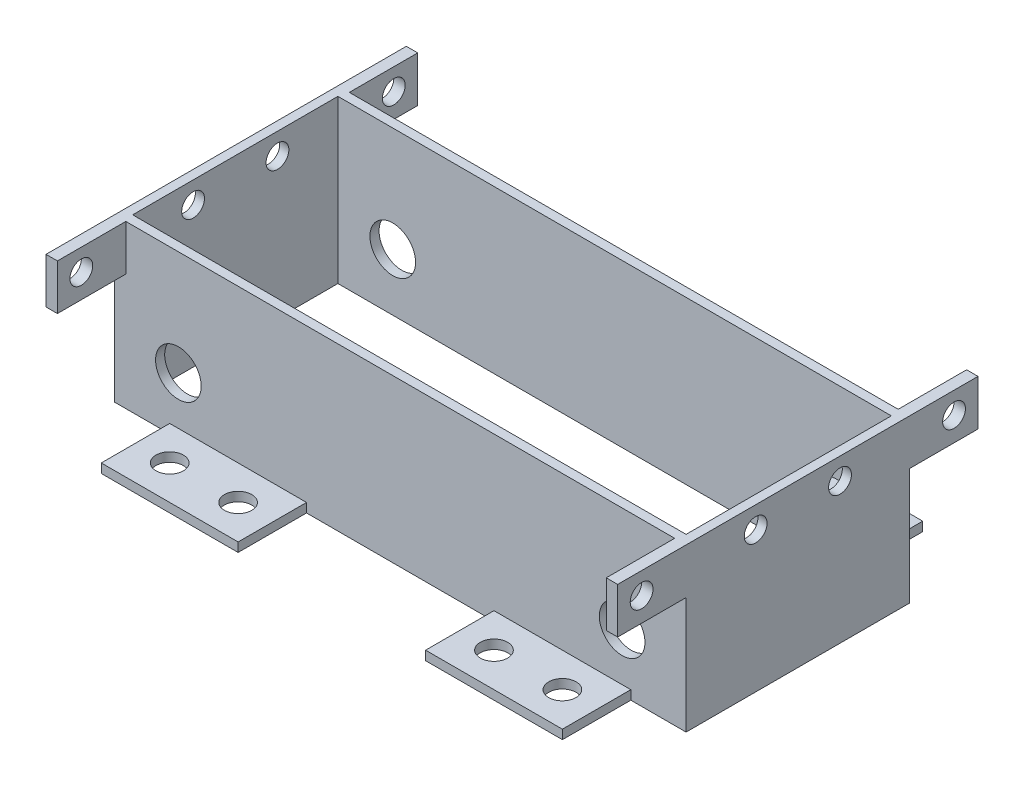
from build123d import *

# Parameters (mm, degrees)
SKETCH1_W           = 125.34
SKETCH1_H           = 35.55
SKETCH1_R           = 5
BOSS_EXTRUDE1_DEPTH = 2
SKETCH2_W           = 2
SKETCH2_H           = 35.55
BOSS_EXTRUDE2_DEPTH = 45
SKETCH4_W           = 30
SKETCH4_H           = 2
BOSS_EXTRUDE3_DEPTH = 15
SKETCH5_W           = 2.5
SKETCH5_H           = 10
BOSS_EXTRUDE4_DEPTH = 15
SKETCH3_R           = 2.5
CUT_EXTRUDE1_DEPTH  = 136.149051883
SKETCH6_R           = 3
CUT_EXTRUDE2_DEPTH  = 125.666080892


with BuildPart() as part:
    # Sketch1 → Boss-Extrude1 (new body)
    with BuildSketch(Plane.XY):
        with Locations((48.645, 5.25)):
            Rectangle(SKETCH1_W, SKETCH1_H)
        Circle(SKETCH1_R, mode=Mode.SUBTRACT)
        with Locations((97.29, 0)):
            Circle(SKETCH1_R, mode=Mode.SUBTRACT)
    boss_extrude1 = extrude(amount=BOSS_EXTRUDE1_DEPTH)

    # Sketch2 → Boss-Extrude2 (add)
    with BuildSketch(Plane(origin=(0, 0, 0), x_dir=(-1, 0, 0), z_dir=(0, 0, -1))):
        with Locations((-110.315, 5.25)):
            Rectangle(SKETCH2_W, SKETCH2_H)
    boss_extrude2 = extrude(amount=BOSS_EXTRUDE2_DEPTH)

    # Mirror1: Boss-Extrude2 across plane
    add(boss_extrude2.mirror(Plane(origin=(48.645, 0, 0), x_dir=(0, 0, 1), z_dir=(1, 0, 0))))

    # Sketch4 → Boss-Extrude3 (add)
    with BuildSketch(Plane.XY.offset(2)):
        with Locations((13.095, -11.525)):
            Rectangle(SKETCH4_W, SKETCH4_H)
        with Locations((84.195, -11.525)):
            Rectangle(SKETCH4_W, SKETCH4_H)
    boss_extrude3 = extrude(amount=BOSS_EXTRUDE3_DEPTH)

    # Sketch5 → Boss-Extrude4 (add)
    with BuildSketch(Plane.XY.offset(2)):
        with Locations((-12.775, 18.025)):
            Rectangle(SKETCH5_W, SKETCH5_H)
        with Locations((110.065, 18.025)):
            Rectangle(SKETCH5_W, SKETCH5_H)
    boss_extrude4 = extrude(amount=BOSS_EXTRUDE4_DEPTH)

    # Sketch3 → Cut-Extrude1 (cut, through all)
    with BuildSketch(Plane(origin=(111.315, 0, 0), x_dir=(0, 0, -1), z_dir=(1, 0, 0))):
        with Locations((13.25, 18.275)):
            Circle(SKETCH3_R)
        with Locations((31.75, 18.275)):
            Circle(SKETCH3_R)
        with Locations((-11.75, 18.275)):
            Circle(SKETCH3_R)
        with Locations((56.75, 18.275)):
            Circle(SKETCH3_R)
    cut_extrude1 = extrude(amount=-CUT_EXTRUDE1_DEPTH, mode=Mode.SUBTRACT)

    # Sketch6 → Cut-Extrude2 (cut, through all)
    with BuildSketch(Plane(origin=(0, -10.525, 0), x_dir=(1, 0, 0), z_dir=(0, 1, 0))):
        with Locations((5.595, -9.5)):
            Circle(SKETCH6_R)
        with Locations((20.595, -9.5)):
            Circle(SKETCH6_R)
        with Locations((91.695, -9.5)):
            Circle(SKETCH6_R)
        with Locations((76.695, -9.5)):
            Circle(SKETCH6_R)
    cut_extrude2 = extrude(amount=-CUT_EXTRUDE2_DEPTH, mode=Mode.SUBTRACT)

    # Mirror2: Boss-Extrude1, Boss-Extrude3, Boss-Extrude4, Cut-Extrude1, Cut-Extrude2 across plane
    add(boss_extrude1.mirror(Plane(origin=(0, 0, -22.5), x_dir=(1, 0, 0), z_dir=(0, 0, -1))))
    add(boss_extrude3.mirror(Plane(origin=(0, 0, -22.5), x_dir=(1, 0, 0), z_dir=(0, 0, -1))))
    add(boss_extrude4.mirror(Plane(origin=(0, 0, -22.5), x_dir=(1, 0, 0), z_dir=(0, 0, -1))))
    add(cut_extrude1.mirror(Plane(origin=(0, 0, -22.5), x_dir=(1, 0, 0), z_dir=(0, 0, -1))), mode=Mode.SUBTRACT)
    add(cut_extrude2.mirror(Plane(origin=(0, 0, -22.5), x_dir=(1, 0, 0), z_dir=(0, 0, -1))), mode=Mode.SUBTRACT)


solid = part.part
